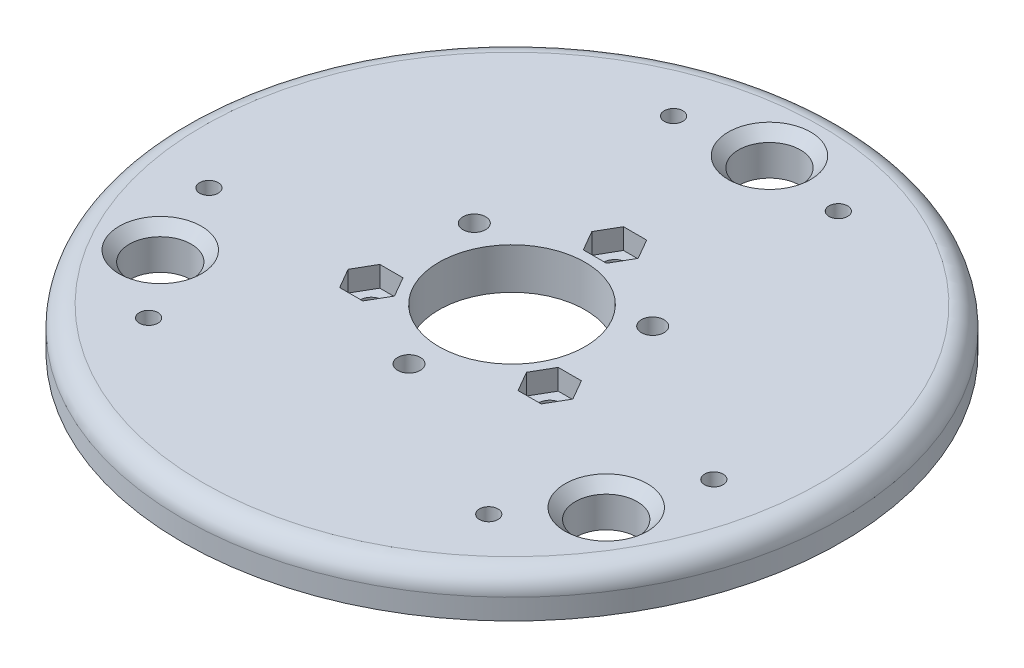
from build123d import *

# Parameters (mm, degrees)
SKETCH_1_R          = 32
SKETCH_1_R_2        = 7.1
SKETCH_1_R_3        = 3
EXTRUDE_1_DEPTH     = 4
FILLET_1_R          = 2
SKETCH_2_R          = 1.1
CUT_EXTRUDE_1_DEPTH = 46.431266766
CUT_EXTRUDE_2_DEPTH = 2
CUT_EXTRUDE_3_DEPTH = 2
CHAMFER_1_SIZE      = 1
SKETCH_5_R          = 0.9
CUT_EXTRUDE_4_DEPTH = 46.431266766


with BuildPart() as part:
    # Эскиз1 → Бобышка-Вытянуть1 (new body)
    with BuildSketch(Plane(origin=(0, 0, 0), x_dir=(1, 0, 0), z_dir=(0, 1, 0))):
        Circle(SKETCH_1_R)
        Circle(SKETCH_1_R_2, mode=Mode.SUBTRACT)
        with Locations((0, 25)):
            Circle(SKETCH_1_R_3, mode=Mode.SUBTRACT)
        with Locations((21.650635095, -12.5)):
            Circle(SKETCH_1_R_3, mode=Mode.SUBTRACT)
        with Locations((-21.650635095, -12.5)):
            Circle(SKETCH_1_R_3, mode=Mode.SUBTRACT)
    extrude(amount=EXTRUDE_1_DEPTH)

    # Скругление1
    fillet_1_edges = [part.edges().sort_by_distance(p)[0] for p in [
        (-32, 4, 0),
    ]]
    fillet(fillet_1_edges, radius=FILLET_1_R)

    # Эскиз2 → Вырез-Вытянуть1 (cut, through all)
    with BuildSketch(Plane(origin=(0, 4, 0), x_dir=(1, 0, 0), z_dir=(0, 1, 0))):
        with Locations((0, 10)):
            Circle(SKETCH_2_R)
        with Locations((8.660254038, 5)):
            Circle(SKETCH_2_R)
        with Locations((8.660254038, -5)):
            Circle(SKETCH_2_R)
        with Locations((0, -10)):
            Circle(SKETCH_2_R)
        with Locations((-8.660254038, -5)):
            Circle(SKETCH_2_R)
        with Locations((-8.660254038, 5)):
            Circle(SKETCH_2_R)
    extrude(amount=-CUT_EXTRUDE_1_DEPTH, mode=Mode.SUBTRACT)

    # Эскиз3 → Вырез-Вытянуть2 (cut)
    with BuildSketch(Plane(origin=(0, 4, 0), x_dir=(1, 0, 0), z_dir=(0, 1, 0))):
        Polygon((9.786087063, -6.95), (10.911920088, -5), (9.786087063, -3.05), (7.534421013, -3.05), (6.408587988, -5), (7.534421013, -6.95), align=None)
        Polygon((1.125833025, 8.05), (2.25166605, 10), (1.125833025, 11.95), (-1.125833025, 11.95), (-2.25166605, 10), (-1.125833025, 8.05), align=None)
        Polygon((-10.911920088, -5), (-9.786087063, -6.95), (-7.534421013, -6.95), (-6.408587988, -5), (-7.534421013, -3.05), (-9.786087063, -3.05), align=None)
    extrude(amount=-CUT_EXTRUDE_2_DEPTH, mode=Mode.SUBTRACT)

    # Эскиз4 → Вырез-Вытянуть3 (cut)
    with BuildSketch(Plane.XZ):
        Polygon((7.534421013, -6.95), (9.786087063, -6.95), (10.911920088, -5), (9.786087063, -3.05), (7.534421013, -3.05), (6.408587988, -5), align=None)
        Polygon((-1.125833025, 8.05), (1.125833025, 8.05), (2.25166605, 10), (1.125833025, 11.95), (-1.125833025, 11.95), (-2.25166605, 10), align=None)
        Polygon((-9.786087063, -3.05), (-10.911920088, -5), (-9.786087063, -6.95), (-7.534421013, -6.95), (-6.408587988, -5), (-7.534421013, -3.05), align=None)
    extrude(amount=-CUT_EXTRUDE_3_DEPTH, mode=Mode.SUBTRACT)

    # Фаска1
    chamfer_1_edges = [part.edges().sort_by_distance(p)[0] for p in [
        (-3, 4, -25),
        (-24.650635095, 4, 12.5),
        (18.650635095, 4, 12.5),
    ]]
    chamfer(chamfer_1_edges, length=CHAMFER_1_SIZE)

    # Эскиз5 → Вырез-Вытянуть4 (cut, through all)
    with BuildSketch(Plane(origin=(0, 4, 0), x_dir=(1, 0, 0), z_dir=(0, 1, 0))):
        with Locations((8, 23.685438565)):
            Circle(SKETCH_5_R)
        with Locations((-8, 23.685438565)):
            Circle(SKETCH_5_R)
        with Locations((24.512191497, -4.914516052)):
            Circle(SKETCH_5_R)
        with Locations((16.512191497, -18.770922513)):
            Circle(SKETCH_5_R)
        with Locations((-16.512191497, -18.770922513)):
            Circle(SKETCH_5_R)
        with Locations((-24.512191497, -4.914516052)):
            Circle(SKETCH_5_R)
    extrude(amount=-CUT_EXTRUDE_4_DEPTH, mode=Mode.SUBTRACT)


solid = part.part
